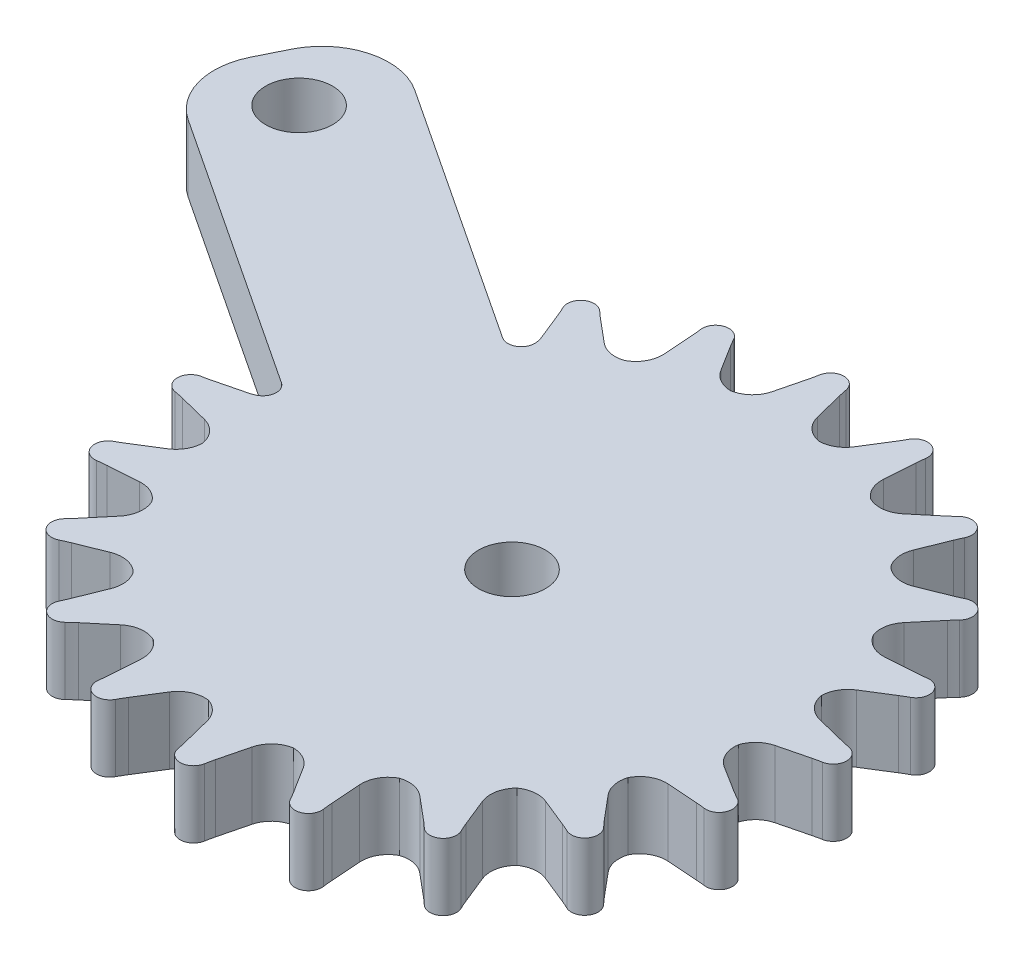
from build123d import *

# Parameters (mm, degrees)
SKETCH1_R           = 20
BOSS_EXTRUDE1_DEPTH = 5
BOSS_EXTRUDE2_START = -5
BOSS_EXTRUDE2_DEPTH = 5
FILLET1_R           = 2
CIRPATTERN1_DEPTH   = 5
SKETCH4_R           = 2.5
BOSS_EXTRUDE3_DEPTH = 5
FILLET2_R           = 5
FILLET3_R           = 1
SKETCH5_R           = 2.5
CUT_EXTRUDE1_DEPTH  = 10
SKETCH7_R           = 5
SKETCH7_R_2         = 2.5
BOSS_EXTRUDE5_DEPTH = 5
FILLET4_R           = 2


# Read off the part's stored shape, not the designer's step: CirPattern1
with BuildPart() as part:
    # Sketch1 → Boss-Extrude1 (new body)
    with BuildSketch(Plane(origin=(0, 0, 0), x_dir=(1, 0, 0), z_dir=(0, 1, 0))):
        with Locations(Location((0, 0, 0), (0, 0, 270))):
            Circle(SKETCH1_R)
    extrude(amount=BOSS_EXTRUDE1_DEPTH)

    # Sketch2 → Boss-Extrude2 (add)
    with BuildSketch(Plane(origin=(0, 5, 0), x_dir=(1, 0, 0), z_dir=(0, 1, 0)).offset(BOSS_EXTRUDE2_START)):
        with BuildLine():
            Line((-2.105791814, 19.888832063), (-1.238592318, 23.357630049))
            ThreePointArc((-1.238592318, 23.357630049), (-1.158488111, 23.704119695), (-1.090754777, 24.053238521))
            ThreePointArc((-1.090754777, 24.053238521), (-0.109023339, 24.880258639), (0.877972386, 24.059528275))
            ThreePointArc((0.877972386, 24.059528275), (0.941143779, 23.742067411), (1.014556469, 23.426817347))
            Line((1.014556469, 23.426817347), (1.893724984, 19.910143286))
            ThreePointArc((1.893724984, 19.910143286), (-0.106567477, 19.999716082), (-2.105791814, 19.888832063))
        make_face()
    extrude(amount=BOSS_EXTRUDE2_DEPTH)

    # Fillet1
    fillet1_edges = [part.edges().sort_by_distance(p)[0] for p in [
        (1.893724984, 2.5, -19.910143286),
        (-2.105791814, 2.5, -19.888832063),
    ]]
    fillet(fillet1_edges, radius=FILLET1_R)

    # CirPattern1 outline → CirPattern1 (add)
    with BuildSketch(Plane(origin=(0, 0, 0), x_dir=(1, 0, 0), z_dir=(0, 1, 0))):
        with BuildLine():
            ThreePointArc((-18.818349161, -15.020578024), (-18.496093443, -14.870168545), (-18.16869336, -14.731312705))
            Line((-18.16869336, -14.731312705), (-16.10451314, -13.898848252))
            ThreePointArc((-16.10451314, -13.898848252), (-14.969635701, -13.791456908), (-13.960430105, -14.321535926))
            ThreePointArc((-13.960430105, -14.321535926), (-16.121714854, -11.835975249), (-17.845731798, -9.029388491))
            ThreePointArc((-17.845731798, -9.029388491), (-17.643410931, -10.160914391), (-18.097403186, -11.216933153))
            Line((-18.097403186, -11.216933153), (-19.549034688, -12.94914432))
            ThreePointArc((-19.549034688, -12.94914432), (-19.760926451, -13.193835771), (-19.980626471, -13.431541317))
            ThreePointArc((-19.980626471, -13.431541317), (-20.064469753, -14.712450836), (-18.818349161, -15.020578024))
        make_face()
        with BuildLine():
            ThreePointArc((-8.242021953, 19.611282475), (-8.490583131, 18.498764143), (-9.306579914, 17.702756009))
            ThreePointArc((-9.306579914, 17.702756009), (-6.422679306, 18.940675556), (-3.380631018, 19.712212811))
            ThreePointArc((-3.380631018, 19.712212811), (-4.340011374, 19.966775936), (-5.058856916, 20.651227642))
            Line((-5.058856916, 20.651227642), (-6.274384144, 22.593742485))
            ThreePointArc((-6.274384144, 22.593742485), (-6.441621387, 22.870877344), (-6.599801755, 23.153279533))
            ThreePointArc((-6.599801755, 23.153279533), (-7.792110102, 23.628842042), (-8.470228911, 22.53892747))
            ThreePointArc((-8.470228911, 22.53892747), (-8.42676349, 22.185964985), (-8.395875928, 21.831680188))
            Line((-8.395875928, 21.831680188), (-8.242021953, 19.611282475))
        make_face()
        with BuildLine():
            ThreePointArc((-13.898848252, 16.10451314), (-13.791456908, 14.969635701), (-14.321535926, 13.960430105))
            ThreePointArc((-14.321535926, 13.960430105), (-11.961321637, 16.028935855), (-9.306579913, 17.702756008))
            ThreePointArc((-9.306579913, 17.702756008), (-10.297669185, 17.648395093), (-11.192839131, 18.077211859))
            Line((-11.192839131, 18.077211859), (-12.94914432, 19.549034688))
            ThreePointArc((-12.94914432, 19.549034688), (-13.193835771, 19.760926451), (-13.431541317, 19.980626471))
            ThreePointArc((-13.431541317, 19.980626471), (-14.712450836, 20.064469753), (-15.020578024, 18.818349161))
            ThreePointArc((-15.020578024, 18.818349161), (-14.870168545, 18.496093443), (-14.731312705, 18.16869336))
            Line((-14.731312705, 18.16869336), (-13.898848252, 16.10451314))
        make_face()
        with BuildLine():
            ThreePointArc((-18.195158445, 11.021321851), (-17.742326793, 9.975175019), (-17.934600217, 8.851560036))
            ThreePointArc((-17.934600217, 8.851560036), (-16.329106467, 11.548172233), (-14.321535925, 13.960430104))
            ThreePointArc((-14.321535925, 13.960430104), (-15.247319388, 13.602466375), (-16.231188267, 13.733672628))
            Line((-16.231188267, 13.733672628), (-18.356352028, 14.59073117))
            ThreePointArc((-18.356352028, 14.59073117), (-18.654545583, 14.716638395), (-18.948508031, 14.852130478))
            ThreePointArc((-18.948508031, 14.852130478), (-20.192634375, 14.536047367), (-20.100608305, 13.255699721))
            ThreePointArc((-20.100608305, 13.255699721), (-19.857977897, 12.995695406), (-19.624745956, 12.727228237))
            Line((-19.624745956, 12.727228237), (-18.195158445, 11.021321851))
        make_face()
        with BuildLine():
            ThreePointArc((-20.710399757, 4.85928679), (-19.956454114, 4.004274704), (-19.792100881, 2.876237597))
            ThreePointArc((-19.792100881, 2.876237597), (-19.098484585, 5.936993052), (-17.934600215, 8.851560035))
            ThreePointArc((-17.934600215, 8.851560035), (-18.704455735, 8.225033474), (-19.680715605, 8.045785833))
            Line((-19.680715605, 8.045785833), (-21.966712103, 8.204185225))
            ThreePointArc((-21.966712103, 8.204185225), (-22.289218499, 8.231783236), (-22.610662757, 8.269804472))
            ThreePointArc((-22.610662757, 8.269804472), (-23.696222171, 7.584735387), (-23.213050996, 6.395490034))
            ThreePointArc((-23.213050996, 6.395490034), (-22.901950013, 6.223188155), (-22.597172338, 6.039933339))
            Line((-22.597172338, 6.039933339), (-20.710399757, 4.85928679))
        make_face()
        with BuildLine():
            ThreePointArc((-21.198362842, -1.778409119), (-20.217104661, -2.358591919), (-19.712212811, -3.380631018))
            ThreePointArc((-19.712212811, -3.380631018), (-19.998369964, -0.255340374), (-19.792100879, 2.876237597))
            ThreePointArc((-19.792100879, 2.876237597), (-20.330669633, 2.042476989), (-21.203757377, 1.570321461))
            Line((-21.203757377, 1.570321461), (-23.426817347, 1.014556469))
            ThreePointArc((-23.426817347, 1.014556469), (-23.74206741, 0.941143779), (-24.059528275, 0.877972386))
            ThreePointArc((-24.059528275, 0.877972386), (-24.880258639, -0.109023339), (-24.053238521, -1.090754777))
            ThreePointArc((-24.053238521, -1.090754777), (-23.704119695, -1.158488111), (-23.357630049, -1.238592318))
            Line((-23.357630049, -1.238592318), (-21.198362842, -1.778409119))
        make_face()
        with BuildLine():
            ThreePointArc((-19.579720151, -8.239834962), (-18.612665626, -8.414862877), (-17.845731799, -9.029388492))
            ThreePointArc((-17.845731799, -9.029388492), (-18.990179463, -6.274797518), (-19.71221281, -3.380631018))
            ThreePointArc((-19.71221281, -3.380631018), (-19.966775936, -4.340011374), (-20.651227642, -5.058856916))
            Line((-20.651227642, -5.058856916), (-22.593742485, -6.274384144))
            ThreePointArc((-22.593742485, -6.274384144), (-22.870877344, -6.441621387), (-23.153279533, -6.599801755))
            ThreePointArc((-23.153279533, -6.599801755), (-23.628842042, -7.792110102), (-22.53892747, -8.470228911))
            ThreePointArc((-22.53892747, -8.470228911), (-22.185964985, -8.42676349), (-21.831680188, -8.395875928))
            Line((-21.831680188, -8.395875928), (-19.579720151, -8.239834962))
        make_face()
        with BuildLine():
            ThreePointArc((3.184529229, 19.744841696), (6.085729599, 19.051611356), (8.851560036, 17.934600217))
            ThreePointArc((8.851560036, 17.934600217), (8.225033474, 18.704455735), (8.045785833, 19.680715605))
            Line((8.045785833, 19.680715605), (8.204185225, 21.966712103))
            ThreePointArc((8.204185225, 21.966712103), (8.231783236, 22.289218499), (8.269804472, 22.610662757))
            ThreePointArc((8.269804472, 22.610662757), (7.584735387, 23.696222171), (6.395490034, 23.213050996))
            ThreePointArc((6.395490034, 23.213050996), (6.223188155, 22.901950013), (6.039933339, 22.597172338))
            Line((6.039933339, 22.597172338), (4.842504233, 20.683579819))
            ThreePointArc((4.842504233, 20.683579819), (4.132483288, 20.004095101), (3.184529229, 19.744841696))
        make_face()
        with BuildLine():
            ThreePointArc((8.851560036, 17.934600217), (11.548172234, 16.329106469), (13.960430106, 14.321535927))
            ThreePointArc((13.960430106, 14.321535927), (13.602466375, 15.247319388), (13.733672628, 16.231188267))
            Line((13.733672628, 16.231188267), (14.59073117, 18.356352028))
            ThreePointArc((14.59073117, 18.356352028), (14.716638395, 18.654545583), (14.852130478, 18.948508031))
            ThreePointArc((14.852130478, 18.948508031), (14.536047367, 20.192634375), (13.255699721, 20.100608305))
            ThreePointArc((13.255699721, 20.100608305), (12.995695406, 19.857977897), (12.727228237, 19.624745956))
            Line((12.727228237, 19.624745956), (11.021321851, 18.195158445))
            ThreePointArc((11.021321851, 18.195158445), (9.975175019, 17.742326793), (8.851560036, 17.934600217))
        make_face()
        with BuildLine():
            ThreePointArc((13.960430106, 14.321535927), (16.028935857, 11.961321639), (17.70275601, 9.306579915))
            ThreePointArc((17.70275601, 9.306579915), (17.648395093, 10.297669185), (18.077211859, 11.192839131))
            Line((18.077211859, 11.192839131), (19.549034688, 12.94914432))
            ThreePointArc((19.549034688, 12.94914432), (19.760926451, 13.193835771), (19.980626471, 13.431541317))
            ThreePointArc((19.980626471, 13.431541317), (20.064469753, 14.712450836), (18.818349161, 15.020578024))
            ThreePointArc((18.818349161, 15.020578024), (18.496093443, 14.870168545), (18.16869336, 14.731312705))
            Line((18.16869336, 14.731312705), (16.10451314, 13.898848252))
            ThreePointArc((16.10451314, 13.898848252), (14.969635701, 13.791456908), (13.960430106, 14.321535927))
        make_face()
        with BuildLine():
            ThreePointArc((17.70275601, 9.306579915), (18.940675558, 6.422679307), (19.712212813, 3.380631018))
            ThreePointArc((19.712212813, 3.380631018), (19.966775936, 4.340011374), (20.651227642, 5.058856916))
            Line((20.651227642, 5.058856916), (22.593742485, 6.274384144))
            ThreePointArc((22.593742485, 6.274384144), (22.870877344, 6.441621387), (23.153279533, 6.599801755))
            ThreePointArc((23.153279533, 6.599801755), (23.628842042, 7.792110102), (22.53892747, 8.470228911))
            ThreePointArc((22.53892747, 8.470228911), (22.185964985, 8.42676349), (21.831680188, 8.395875928))
            Line((21.831680188, 8.395875928), (19.611282475, 8.242021953))
            ThreePointArc((19.611282475, 8.242021953), (18.498764143, 8.490583131), (17.70275601, 9.306579915))
        make_face()
        with BuildLine():
            ThreePointArc((19.712212813, 3.380631018), (19.998369968, 0.255340374), (19.792100883, -2.876237597))
            ThreePointArc((19.792100883, -2.876237597), (20.330669633, -2.042476989), (21.203757377, -1.570321461))
            Line((21.203757377, -1.570321461), (23.426817347, -1.014556469))
            ThreePointArc((23.426817347, -1.014556469), (23.74206741, -0.941143779), (24.059528275, -0.877972386))
            ThreePointArc((24.059528275, -0.877972386), (24.880258639, 0.109023339), (24.053238521, 1.090754777))
            ThreePointArc((24.053238521, 1.090754777), (23.704119695, 1.158488111), (23.357630049, 1.238592318))
            Line((23.357630049, 1.238592318), (21.198362842, 1.778409119))
            ThreePointArc((21.198362842, 1.778409119), (20.217104661, 2.358591919), (19.712212813, 3.380631018))
        make_face()
        with BuildLine():
            ThreePointArc((19.792100883, -2.876237597), (19.051611357, -6.085729599), (17.794386708, -9.130158911))
            ThreePointArc((17.794386708, -9.130158911), (18.590889166, -8.301383653), (19.712076244, -8.047958848))
            Line((19.712076244, -8.047958848), (21.966712103, -8.204185225))
            ThreePointArc((21.966712103, -8.204185225), (22.289218499, -8.231783236), (22.610662757, -8.269804472))
            ThreePointArc((22.610662757, -8.269804472), (23.696222171, -7.584735387), (23.213050996, -6.395490034))
            ThreePointArc((23.213050996, -6.395490034), (22.901950013, -6.223188155), (22.597172338, -6.039933339))
            Line((22.597172338, -6.039933339), (20.710399757, -4.85928679))
            ThreePointArc((20.710399757, -4.85928679), (19.956454114, -4.004274704), (19.792100883, -2.876237597))
        make_face()
        with BuildLine():
            ThreePointArc((17.794386708, -9.130158911), (16.238565258, -11.675144471), (14.321535927, -13.960430106))
            ThreePointArc((14.321535927, -13.960430106), (15.247319388, -13.602466375), (16.231188267, -13.733672628))
            Line((16.231188267, -13.733672628), (18.356352028, -14.59073117))
            ThreePointArc((18.356352028, -14.59073117), (18.654545583, -14.716638395), (18.948508031, -14.852130478))
            ThreePointArc((18.948508031, -14.852130478), (20.192634375, -14.536047367), (20.100608305, -13.255699721))
            ThreePointArc((20.100608305, -13.255699721), (19.857977897, -12.995695406), (19.624745956, -12.727228237))
            Line((19.624745956, -12.727228237), (18.174837264, -10.997072875))
            ThreePointArc((18.174837264, -10.997072875), (17.748017433, -10.111830503), (17.794386708, -9.130158911))
        make_face()
        with BuildLine():
            ThreePointArc((14.321535927, -13.960430106), (11.961321639, -16.028935857), (9.306579914, -17.70275601))
            ThreePointArc((9.306579914, -17.70275601), (10.297669185, -17.648395093), (11.192839131, -18.077211859))
            Line((11.192839131, -18.077211859), (12.94914432, -19.549034688))
            ThreePointArc((12.94914432, -19.549034688), (13.193835771, -19.760926451), (13.431541317, -19.980626471))
            ThreePointArc((13.431541317, -19.980626471), (14.712450836, -20.064469753), (15.020578024, -18.818349161))
            ThreePointArc((15.020578024, -18.818349161), (14.870168545, -18.496093443), (14.731312705, -18.16869336))
            Line((14.731312705, -18.16869336), (13.898848252, -16.10451314))
            ThreePointArc((13.898848252, -16.10451314), (13.791456908, -14.969635701), (14.321535927, -13.960430106))
        make_face()
        with BuildLine():
            ThreePointArc((9.306579914, -17.70275601), (6.422679306, -18.940675557), (3.380631018, -19.712212812))
            ThreePointArc((3.380631018, -19.712212812), (4.340011374, -19.966775936), (5.058856916, -20.651227642))
            Line((5.058856916, -20.651227642), (6.274384144, -22.593742485))
            ThreePointArc((6.274384144, -22.593742485), (6.441621387, -22.870877344), (6.599801755, -23.153279533))
            ThreePointArc((6.599801755, -23.153279533), (7.792110102, -23.628842042), (8.470228911, -22.53892747))
            ThreePointArc((8.470228911, -22.53892747), (8.42676349, -22.185964985), (8.395875928, -21.831680188))
            Line((8.395875928, -21.831680188), (8.242021953, -19.611282475))
            ThreePointArc((8.242021953, -19.611282475), (8.490583131, -18.498764143), (9.306579914, -17.70275601))
        make_face()
        with BuildLine():
            ThreePointArc((3.380631018, -19.712212812), (0.255340374, -19.998369966), (-2.876237597, -19.792100881))
            ThreePointArc((-2.876237597, -19.792100881), (-2.042476989, -20.330669633), (-1.570321461, -21.203757377))
            Line((-1.570321461, -21.203757377), (-1.014556469, -23.426817347))
            ThreePointArc((-1.014556469, -23.426817347), (-0.941143779, -23.74206741), (-0.877972386, -24.059528275))
            ThreePointArc((-0.877972386, -24.059528275), (0.109023339, -24.880258639), (1.090754777, -24.053238521))
            ThreePointArc((1.090754777, -24.053238521), (1.158488111, -23.704119695), (1.238592318, -23.357630049))
            Line((1.238592318, -23.357630049), (1.778409119, -21.198362842))
            ThreePointArc((1.778409119, -21.198362842), (2.358591919, -20.217104661), (3.380631018, -19.712212812))
        make_face()
        with BuildLine():
            ThreePointArc((-2.876237597, -19.792100881), (-5.936993053, -19.098484586), (-8.851560035, -17.934600216))
            ThreePointArc((-8.851560035, -17.934600216), (-8.225033474, -18.704455735), (-8.045785833, -19.680715605))
            Line((-8.045785833, -19.680715605), (-8.204185225, -21.966712103))
            ThreePointArc((-8.204185225, -21.966712103), (-8.231783236, -22.289218499), (-8.269804472, -22.610662757))
            ThreePointArc((-8.269804472, -22.610662757), (-7.584735387, -23.696222171), (-6.395490034, -23.213050996))
            ThreePointArc((-6.395490034, -23.213050996), (-6.223188155, -22.901950013), (-6.039933339, -22.597172338))
            Line((-6.039933339, -22.597172338), (-4.85928679, -20.710399757))
            ThreePointArc((-4.85928679, -20.710399757), (-4.004274704, -19.956454114), (-2.876237597, -19.792100881))
        make_face()
        with BuildLine():
            ThreePointArc((-8.851560035, -17.934600216), (-11.548172233, -16.329106468), (-13.960430104, -14.321535925))
            ThreePointArc((-13.960430104, -14.321535925), (-13.602466375, -15.247319388), (-13.733672628, -16.231188267))
            Line((-13.733672628, -16.231188267), (-14.59073117, -18.356352028))
            ThreePointArc((-14.59073117, -18.356352028), (-14.716638395, -18.654545583), (-14.852130478, -18.948508031))
            ThreePointArc((-14.852130478, -18.948508031), (-14.536047367, -20.192634375), (-13.255699721, -20.100608305))
            ThreePointArc((-13.255699721, -20.100608305), (-12.995695406, -19.857977897), (-12.727228237, -19.624745956))
            Line((-12.727228237, -19.624745956), (-11.021321851, -18.195158445))
            ThreePointArc((-11.021321851, -18.195158445), (-9.975175019, -17.742326793), (-8.851560035, -17.934600216))
        make_face()
    extrude(amount=CIRPATTERN1_DEPTH)

    # Sketch4 → Boss-Extrude3 (add)
    with BuildSketch(Plane.XZ):
        Polygon((-19.792100881, -2.876237597), (-44.829083623, -19.40347255), (-39.358518667, -30.487665059), (-14.321535926, -13.960430105), align=None)
        with Locations(Location((-37.947106751, -22.049955634, 0), (0, 0, 270))):
            Circle(SKETCH4_R, mode=Mode.SUBTRACT)
    extrude(amount=-BOSS_EXTRUDE3_DEPTH)

    # Fillet2
    fillet2_edges = [part.edges().sort_by_distance(p)[0] for p in [
        (-39.358518667, 2.5, -30.487665059),
        (-44.829083623, 2.5, -19.40347255),
    ]]
    fillet(fillet2_edges, radius=FILLET2_R)

    # Fillet3
    fillet3_edges = [part.edges().sort_by_distance(p)[0] for p in [
        (-14.321535926, 2.5, -13.960430105),
        (-19.792100881, 2.5, -2.876237597),
    ]]
    fillet(fillet3_edges, radius=FILLET3_R)

    # Sketch5 → Cut-Extrude1 (cut)
    with BuildSketch(Plane(origin=(0, 5, 0), x_dir=(1, 0, 0), z_dir=(0, 1, 0))):
        with Locations(Location((0, 0, 0), (0, 0, 270))):
            Circle(SKETCH5_R)
    extrude(amount=-CUT_EXTRUDE1_DEPTH, mode=Mode.SUBTRACT)

    # Sketch7 → Boss-Extrude5 (add)
    with BuildSketch(Plane.XZ):
        with Locations(Location((0, 0, 0), (0, 0, 90))):
            Circle(SKETCH7_R)
        with Locations(Location((0, 0, 0), (0, 0, 90))):
            Circle(SKETCH7_R_2, mode=Mode.SUBTRACT)
    extrude(amount=BOSS_EXTRUDE5_DEPTH)

    # Fillet4
    fillet4_edges = [part.edges().sort_by_distance(p)[0] for p in [
        (0, 0, -5),
    ]]
    fillet(fillet4_edges, radius=FILLET4_R)


solid = part.part
